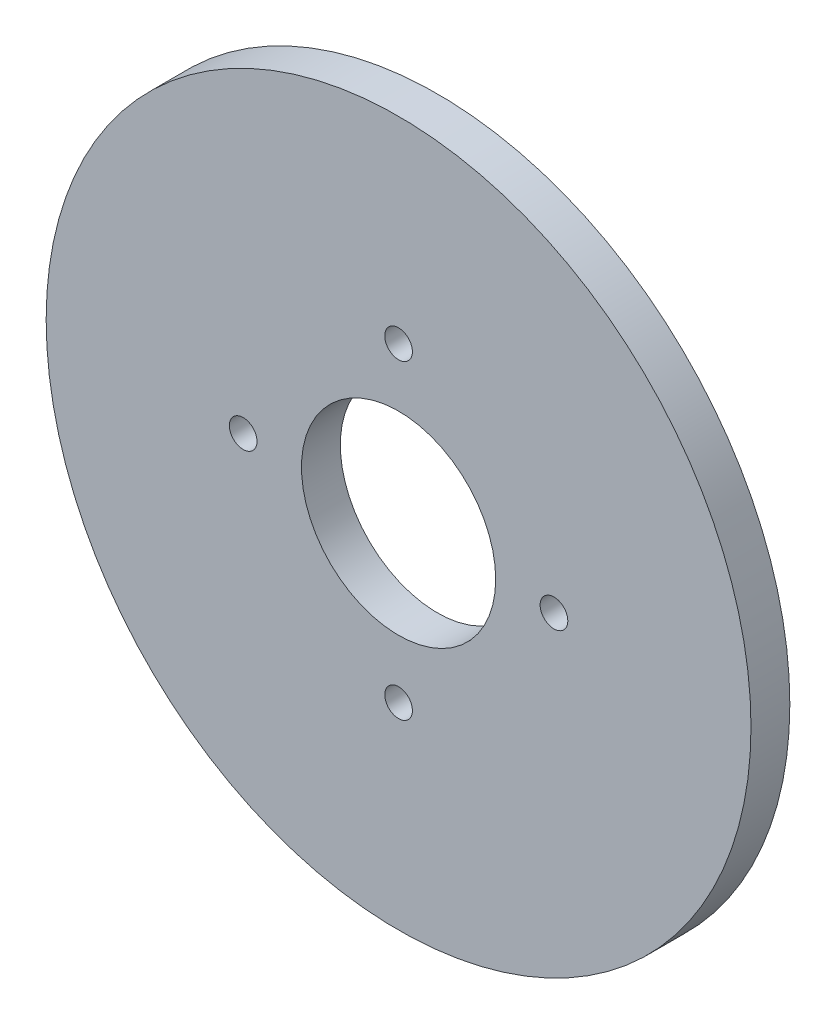
from build123d import *

# Parameters (mm, degrees)
SKETCH1_R                     = 28.8036
SKETCH1_R_2                   = 7.9375
BOSS_EXTRUDE1_DEPTH           = 3.175
TAP_DRILL_FOR_4_40_TAP1_D     = 2.2606
TAP_DRILL_FOR_4_40_TAP1_DEPTH = 4
TAP_DRILL_FOR_4_40_TAP1_TIP   = 0.679152758


with BuildPart() as part:
    # Sketch1 → Boss-Extrude1 (new body)
    with BuildSketch(Plane.XY):
        Circle(SKETCH1_R)
        Circle(SKETCH1_R_2, mode=Mode.SUBTRACT)
    extrude(amount=BOSS_EXTRUDE1_DEPTH)

    # Tap Drill for #4-40 Tap1
    with Locations(Plane.XY.offset(3.175)):
        with Locations((0, 12.7), (0, -12.7), (12.7, 0), (-12.7, 0)):
            Hole(TAP_DRILL_FOR_4_40_TAP1_D / 2, depth=TAP_DRILL_FOR_4_40_TAP1_DEPTH)
            with Locations((0, 0, -(TAP_DRILL_FOR_4_40_TAP1_DEPTH + TAP_DRILL_FOR_4_40_TAP1_TIP / 2))):  # 118° drill point
                Cone(0, TAP_DRILL_FOR_4_40_TAP1_D / 2, TAP_DRILL_FOR_4_40_TAP1_TIP, mode=Mode.SUBTRACT)


solid = part.part
